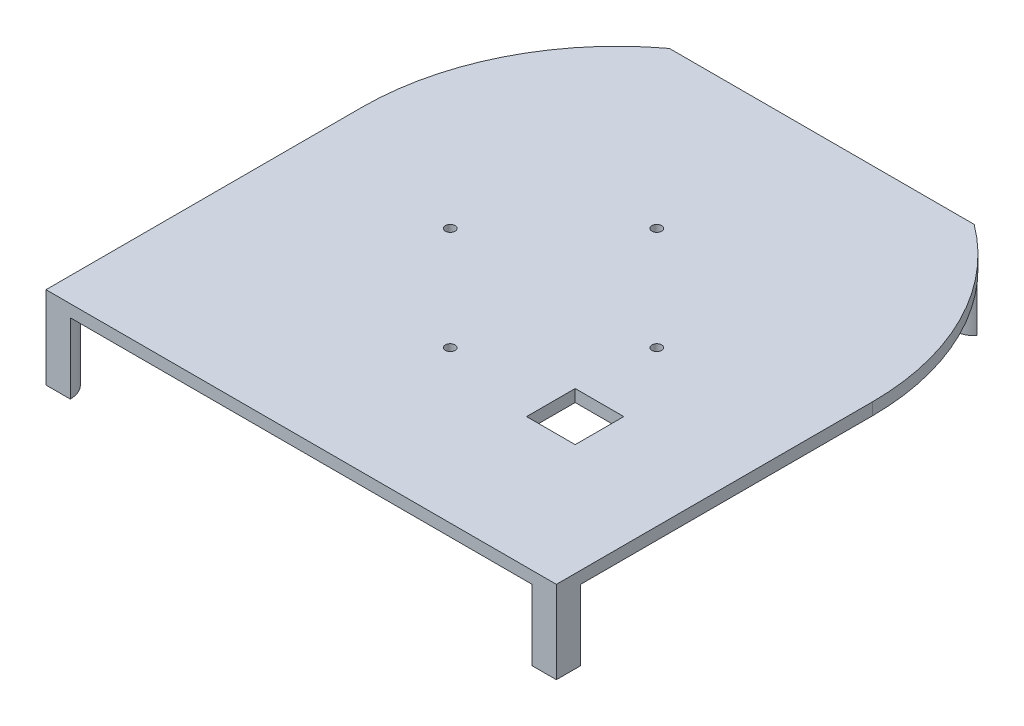
from build123d import *

# Parameters (mm, degrees)
BOSS_EXTRUDE1_DEPTH = 5
SKETCH2_W           = 213.862691863
SKETCH2_H           = 54.913039258
CUT_EXTRUDE1_DEPTH  = 5
BOSS_EXTRUDE2_START = 29
BOSS_EXTRUDE2_DEPTH = 29
SKETCH4_W           = 6
SKETCH4_H           = 6
BOSS_EXTRUDE3_DEPTH = 30
SKETCH5_W           = 6
SKETCH5_H           = 6
BOSS_EXTRUDE4_DEPTH = 30
FILLET1_R           = 10
SKETCH7_R           = 2
CUT_EXTRUDE2_DEPTH  = 29
SKETCH8_W           = 20
SKETCH8_H           = 20
CUT_EXTRUDE3_DEPTH  = 10


with BuildPart() as part:
    # Sketch1 → Boss-Extrude1 (new body)
    with BuildSketch(Plane(origin=(0, 0, 0), x_dir=(1, 0, 0), z_dir=(0, 1, 0))):
        with BuildLine():
            Line((0, 130), (0, 0))
            Line((0, 0), (210, 0))
            Line((210, 0), (210, 130))
            ThreePointArc((210, 130), (105, 235), (0, 130))
        make_face()
    extrude(amount=BOSS_EXTRUDE1_DEPTH)

    # Sketch2 → Cut-Extrude1 (cut)
    with BuildSketch(Plane(origin=(0, 5, 0), x_dir=(1, 0, 0), z_dir=(0, 1, 0))):
        with Locations((106.931345932, 241.686519629)):
            Rectangle(SKETCH2_W, SKETCH2_H)
    extrude(amount=-CUT_EXTRUDE1_DEPTH, mode=Mode.SUBTRACT)

    # Sketch3 → Boss-Extrude2 (add)
    with BuildSketch(Plane(origin=(0, 0, 0), x_dir=(-1, 0, 0), z_dir=(0, -1, 0)).offset(BOSS_EXTRUDE2_START)):
        with BuildLine():
            Line((-42.307838608, 214.23), (-50.307838608, 214.23))
            ThreePointArc((-50.307838608, 214.23), (-44.96798765, 206.685226506), (-36.076936839, 209.212444505))
            ThreePointArc((-36.076936839, 209.212444505), (-39.144584131, 211.78058572), (-42.307838608, 214.23))
        make_face()
        with BuildLine():
            ThreePointArc((-173.923063161, 209.212444505), (-165.03201235, 206.685226506), (-159.692161392, 214.23))
            Line((-159.692161392, 214.23), (-167.692161392, 214.23))
            ThreePointArc((-167.692161392, 214.23), (-170.855415869, 211.78058572), (-173.923063161, 209.212444505))
        make_face()
        with BuildLine():
            Line((0, 0), (0, 10))
            ThreePointArc((0, 10), (-7.071067812, 7.071067812), (-10, 0))
            Line((-10, 0), (0, 0))
        make_face()
        with BuildLine():
            ThreePointArc((-200, 0), (-202.928932188, 7.071067812), (-210, 10))
            Line((-210, 10), (-210, 0))
            Line((-210, 0), (-200, 0))
        make_face()
    extrude(amount=-BOSS_EXTRUDE2_DEPTH)

    # Sketch4 → Boss-Extrude3 (add)
    with BuildSketch(Plane.XZ):
        with Locations((171, -87)):
            Rectangle(SKETCH4_W, SKETCH4_H)
    extrude(amount=BOSS_EXTRUDE3_DEPTH)

    # Sketch5 → Boss-Extrude4 (add)
    with BuildSketch(Plane(origin=(0, 0, 0), x_dir=(-1, 0, 0), z_dir=(0, -1, 0))):
        with Locations((-72, 112)):
            Rectangle(SKETCH5_W, SKETCH5_H)
    extrude(amount=BOSS_EXTRUDE4_DEPTH)

    # Fillet1
    fillet1_edges = [part.edges().sort_by_distance(p)[0] for p in [
        (171, 0, -84),
        (168, 0, -87),
        (174, 0, -87),
        (171, 0, -90),
        (72, 0, -109),
        (69, 0, -112),
        (72, 0, -115),
        (75, 0, -112),
    ]]
    fillet(fillet1_edges, radius=FILLET1_R)

    # Sketch7 → Cut-Extrude2 (cut)
    with BuildSketch(Plane(origin=(0, 5, 0), x_dir=(1, 0, 0), z_dir=(0, 1, 0))):
        with Locations((103.829013771, 147.5)):
            Circle(SKETCH7_R)
        with Locations((146.329013771, 105)):
            Circle(SKETCH7_R)
        with Locations((103.829013771, 62.5)):
            Circle(SKETCH7_R)
        with Locations((61.329013771, 105)):
            Circle(SKETCH7_R)
    extrude(amount=-CUT_EXTRUDE2_DEPTH, mode=Mode.SUBTRACT)

    # Sketch8 → Cut-Extrude3 (cut)
    with BuildSketch(Plane(origin=(0, 5, 0), x_dir=(1, 0, 0), z_dir=(0, 1, 0))):
        with Locations((154.091797389, 63.651218277)):
            Rectangle(SKETCH8_W, SKETCH8_H)
    extrude(amount=-CUT_EXTRUDE3_DEPTH, mode=Mode.SUBTRACT)


solid = part.part
